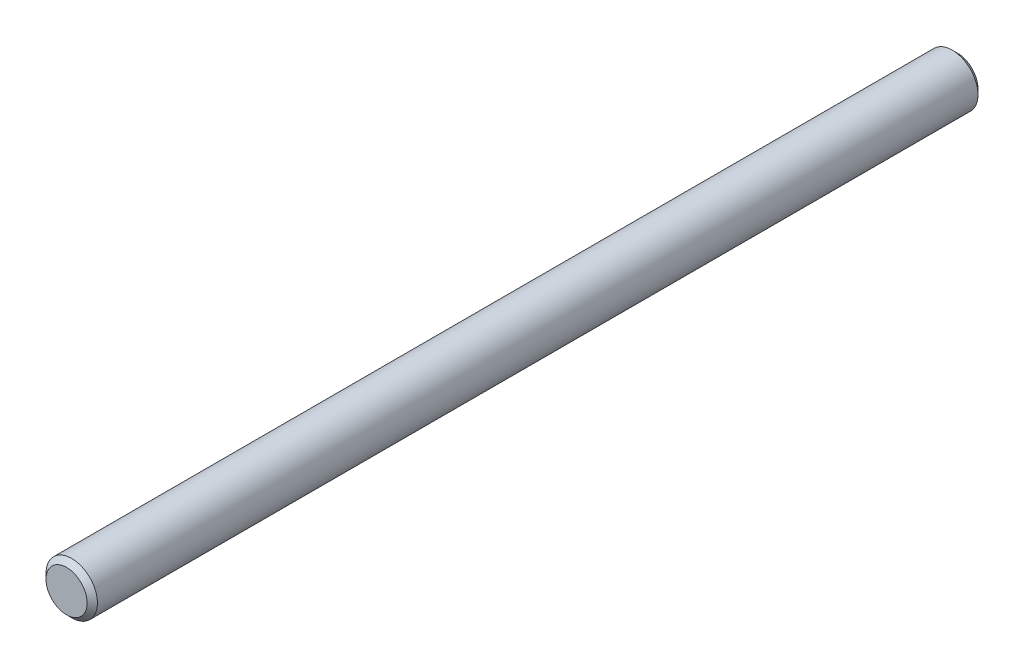
from build123d import *

# Parameters (mm, degrees)
SKETCH1_R      = 6.35
EXTRUDE1_DEPTH = 110
CHAMFER1_SIZE  = 1.27


with BuildPart() as part:
    # Sketch1 → Extrude1 (new, symmetric)
    with BuildSketch(Plane.XY):
        Circle(SKETCH1_R)
    extrude(amount=EXTRUDE1_DEPTH, both=True)

    # Chamfer1
    chamfer1_edges = [part.edges().sort_by_distance(p)[0] for p in [
        (-6.35, 0, -110),
        (-6.35, 0, 110),
    ]]
    chamfer(chamfer1_edges, length=CHAMFER1_SIZE)


solid = part.part
